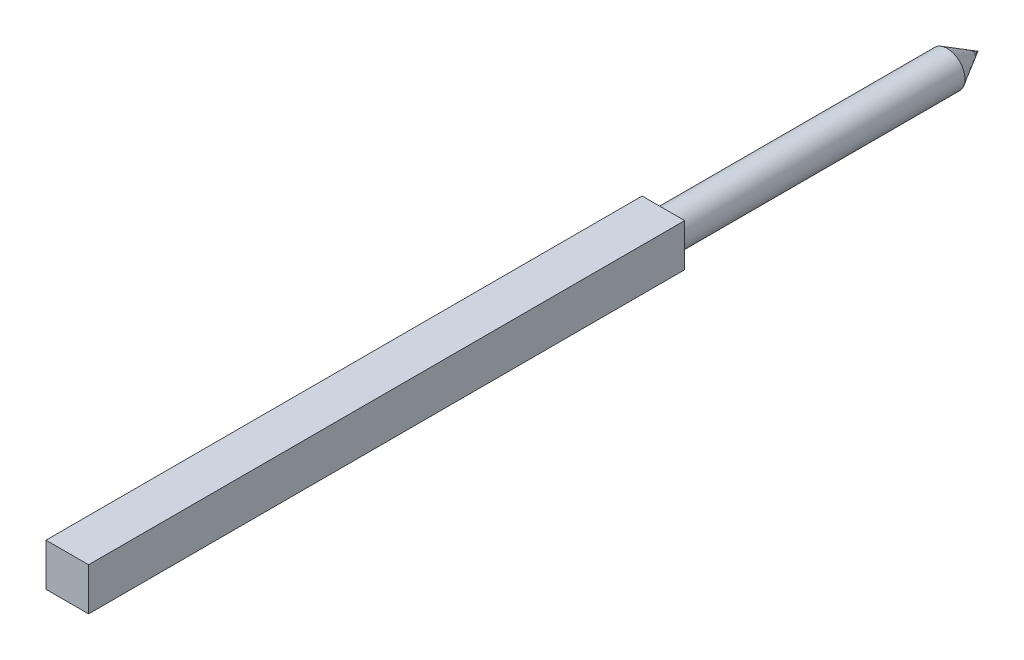
from build123d import *

# Parameters (mm, degrees)
SKETCH1_W           = 6
SKETCH1_H           = 6
BOSS_EXTRUDE1_DEPTH = 84
SKETCH1_4_R         = 2.5
BOSS_EXTRUDE2_DEPTH = 40


with BuildPart() as part:
    # Sketch1 → Boss-Extrude1 (new body)
    with BuildSketch(Plane.XY):
        Rectangle(SKETCH1_W, SKETCH1_H)
    extrude(amount=BOSS_EXTRUDE1_DEPTH)

    # Sketch1<4> → Boss-Extrude2 (add)
    with BuildSketch(Plane.XY):
        Circle(SKETCH1_4_R)
    extrude(amount=-BOSS_EXTRUDE2_DEPTH)

    # Boss-Extrude3 cone 1 section (through the dimple's axis) → Boss-Extrude3 (revolve)
    with BuildSketch(Plane(origin=(0, 0, -40), x_dir=(0, -1, 0), z_dir=(1, 0, 0))):
        Polygon((0, 0), (2.5, 0), (0, 4.330127019), align=None)
    revolve(axis=Axis((0, 0, -40), (0, 0, -1)))


solid = part.part
